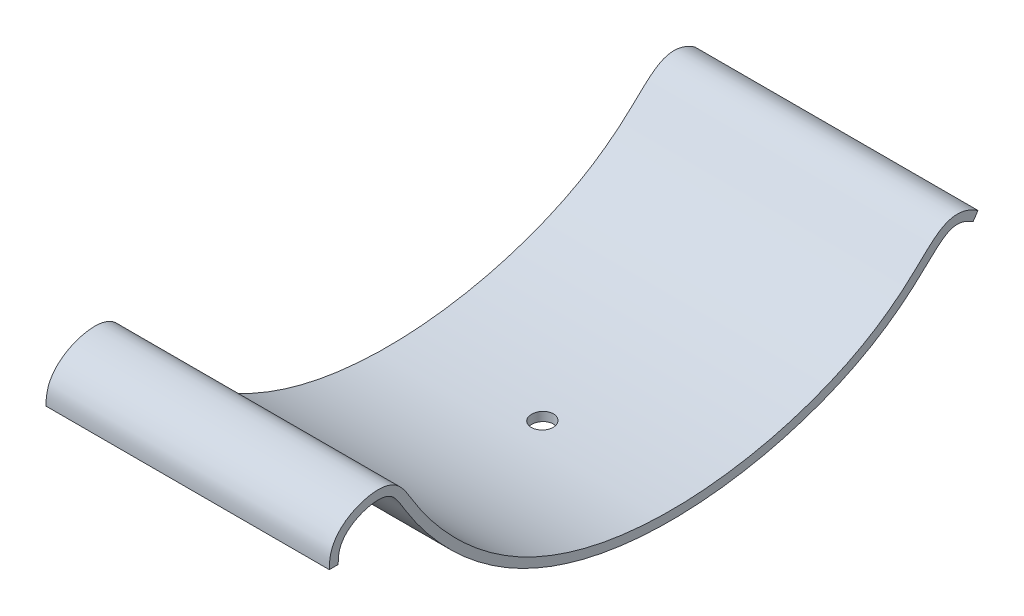
from build123d import *

# Parameters (mm, degrees)
BOSS_EXTRUDE1_START = -8.128
BOSS_EXTRUDE1_DEPTH = 16.256
SKETCH2_R           = 0.635
CUT_EXTRUDE1_DEPTH  = 24.14392284


# Read off the part's stored shape, not the designer's step: Boss-Extrude1
with BuildPart() as part:
    # Boss-Extrude1 outline → Boss-Extrude1 (new body)
    with BuildSketch(Plane(origin=(0, 0, 0), x_dir=(0, 0, -1), z_dir=(1, 0, 0)).offset(BOSS_EXTRUDE1_START)):
        with BuildLine():
            Line((16.589019195, -1.256697512), (16.871674811, -0.834595863))
            add(Edge.make_bspline(
                [(16.871674811, -0.834595863), (16.758038505, -0.75850059), (16.51009055, -0.614751083), (16.065519539, -0.442822428), (15.535153537, -0.390397203), (14.980361869, -0.554381658), (14.339433306, -0.959441699), (13.597048531, -1.67781893), (12.511187531, -2.695713429), (11.088553964, -3.757193436), (8.690936178, -5.103805333), (4.844469034, -6.449678032), (-0.254465304, -7.097122263), (-4.914822622, -6.692120179), (-8.649373097, -5.447166211), (-11.402574344, -3.739972502), (-13.345441539, -1.959102206), (-14.6617064, -0.394174789), (-15.488377758, 0.826616531), (-15.998453091, 1.734881639), (-16.695033808, 2.457162767), (-17.782566836, 2.562498252), (-18.854653902, 2.239818945), (-19.653263902, 1.765078821), (-20.153134502, 1.122572764), (-20.333910082, 0.474617449), (-20.353652997, 0.104773323), (-20.353652997, -0.075064513)],
                knots=[0, 0, 0, 0, 0.0078125, 0.015625, 0.03125, 0.046875, 0.0625, 0.09375, 0.125, 0.15625, 0.1875, 0.25, 0.3125, 0.375, 0.4375, 0.5, 0.5625, 0.625, 0.6875, 0.75, 0.8125, 0.875, 0.90625, 0.9375, 0.96875, 0.984375, 1, 1, 1, 1], degree=3))
            Line((-20.353652997, -0.075064513), (-19.845652997, -0.075064513))
            add(Edge.make_bspline(
                [(-19.845652997, -0.075064513), (-19.845652997, 0.077830121), (-19.827172901, 0.405127673), (-19.690271072, 0.879281159), (-19.321735307, 1.364526452), (-18.650721916, 1.770618171), (-17.717040393, 2.047282514), (-16.90982415, 1.948815353), (-16.453414048, 1.479834818), (-15.917379729, 0.560492217), (-15.066542955, -0.704210581), (-13.712743047, -2.311581751), (-11.711754469, -4.146951197), (-8.863598265, -5.913050937), (-5.01215724, -7.195424043), (-0.239508784, -7.608648383), (4.957390091, -6.947336631), (9.684001968, -5.301246748), (12.469998284, -3.436691491), (13.955189729, -2.035761038), (14.678792005, -1.342652927), (15.204338255, -1.018135012), (15.583909243, -0.909597338), (15.944142542, -0.942711315), (16.284967473, -1.072052441), (16.494855689, -1.193641981), (16.589019195, -1.256697512)],
                knots=[0, 0, 0, 0, 0.015625, 0.03125, 0.0625, 0.09375, 0.125, 0.1875, 0.25, 0.3125, 0.375, 0.4375, 0.5, 0.5625, 0.625, 0.6875, 0.75, 0.8125, 0.875, 0.90625, 0.9375, 0.953125, 0.96875, 0.984375, 0.9921875, 1, 1, 1, 1], degree=3))
        make_face()
    extrude(amount=BOSS_EXTRUDE1_DEPTH)

    # Sketch2 → Cut-Extrude1 (cut, through all)
    with BuildSketch(Plane(origin=(0, 0, 0), x_dir=(1, 0, 0), z_dir=(0, 1, 0))):
        with Locations(Location((0, 0, 0), (0, 0, 270))):
            Circle(SKETCH2_R)
    extrude(amount=-CUT_EXTRUDE1_DEPTH, mode=Mode.SUBTRACT)


solid = part.part
